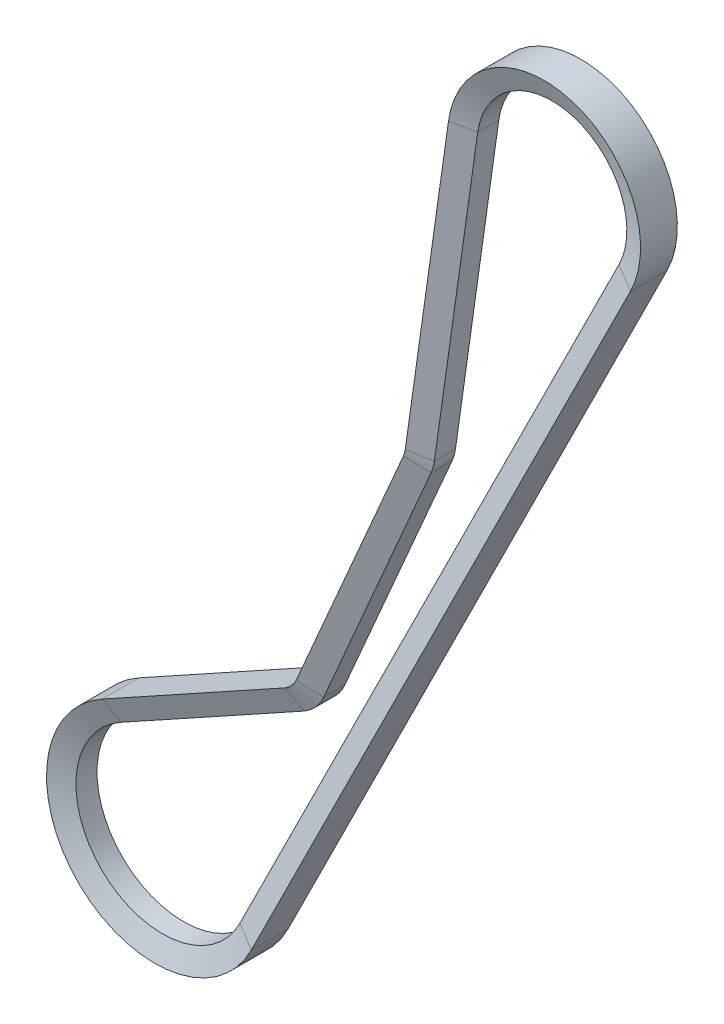
from build123d import *


with BuildPart() as part:
    # Sweep1: sweep along a path in Sketch2
    with BuildLine(Plane.XY) as sweep1_path:
        Line((22.371129054, -11.159416868), (-75.822608527, -208.007048044))
        ThreePointArc((-75.822608527, -208.007048044), (-120.251874512, -215.723930089), (-114.430616012, -171.006786912))
        Line((-114.430616012, -171.006786912), (-66.989914092, -144.766473454))
        ThreePointArc((-66.989914092, -144.766473454), (-65.36142054, -143.477616975), (-64.235878722, -141.732252288))
        Line((-64.235878722, -141.732252288), (-36.429700457, -77.491949905))
        ThreePointArc((-36.429700457, -77.491949905), (-36.144866675, -76.690495712), (-35.969699532, -75.8581643))
        Line((-35.969699532, -75.8581643), (-24.753992401, 3.498551162))
        ThreePointArc((-24.753992401, 3.498551162), (7.425194686, 23.871876421), (22.371129054, -11.159416868))
    # Sketch3 → Sweep1 (sweep)
    with BuildSketch(Plane(origin=(-24.753992401, 3.498551162, 0), x_dir=(0.990159696021212, -0.13994204648775485, 0), z_dir=(0.13994204648775485, 0.9901596960212121, 0))):
        Polygon((0, -4.7625), (0, 4.7625), (5.588, 2.728634331), (5.588, -2.728634331), align=None)
    sweep(path=sweep1_path.line)


solid = part.part
